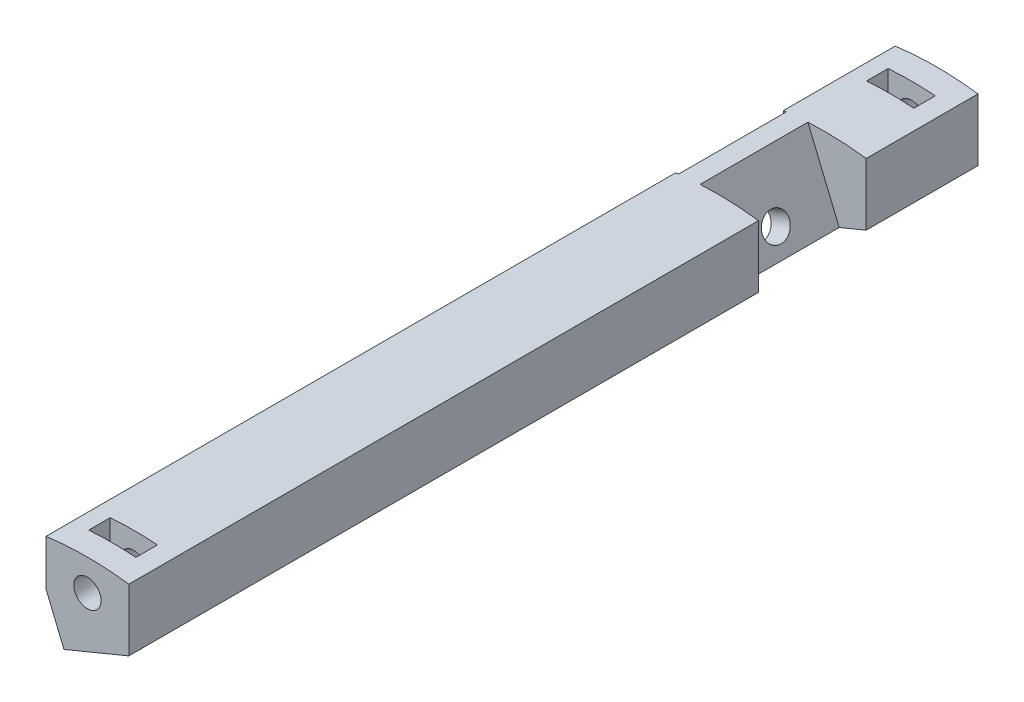
from build123d import *

# Parameters (mm, degrees)
BOSS_EXTRU_2_DEPTH       = 102.5
ESQUISSE8_R              = 1.75
ENL_V_MAT_EXTRU_5_DEPTH  = 11.5
ENL_V_START              = -3
ENL_V_MAT_EXTRU_6_DEPTH  = 2.6
ENL_V_START_2            = -89
ENL_V_MAT_EXTRU_11_DEPTH = 13
ESQUISSE15_R             = 1.625
ENL_V_MAT_EXTRU_12_DEPTH = 109.858621468
CHANFREIN1_SIZE          = 2.5
ESQUISSE16_R             = 1.65
ENL_V_MAT_EXTRU_13_DEPTH = 11.5
ENL_V_START_3            = -5.6
ENL_V_MAT_EXTRU_14_DEPTH = 2.6


with BuildPart() as part:
    # Esquisse3 → Boss.-Extru.2 (new body)
    with BuildSketch(Plane.XY):
        with BuildLine():
            Line((5, 29.665669478), (-2.833530831, 26.427314208))
            Line((-2.833530831, 26.427314208), (-5, 31.657633458))
            Line((-5, 31.657633458), (-5, 37.165171868))
            ThreePointArc((-5, 37.165171868), (0, 37.5), (5, 37.165171868))
            Line((5, 37.165171868), (5, 29.665669478))
        make_face()
    extrude(amount=BOSS_EXTRU_2_DEPTH)

    # Esquisse8 → Enlèv. mat.-Extru.5 (cut)
    with BuildSketch(Plane(origin=(0, 0, 0), x_dir=(-1, 0, 0), z_dir=(0, 0, -1))):
        with Locations((0, 33.75)):
            Circle(ESQUISSE8_R)
    extrude(amount=-ENL_V_MAT_EXTRU_5_DEPTH, mode=Mode.SUBTRACT)

    # Esquisse9 → Enlèv. mat.-Extru.6 (cut)
    with BuildSketch(Plane(origin=(0, 0, 0), x_dir=(-1, 0, 0), z_dir=(0, 0, -1)).offset(ENL_V_START)):
        with BuildLine():
            Line((-2.85, 37.391543162), (-2.85, 31.995448267))
            Line((-2.85, 31.995448267), (0, 30.35))
            Line((0, 30.35), (2.85, 31.995448267))
            Line((2.85, 31.995448267), (2.85, 37.391543162))
            ThreePointArc((2.85, 37.391543162), (0, 37.5), (-2.85, 37.391543162))
        make_face()
    extrude(amount=-ENL_V_MAT_EXTRU_6_DEPTH, mode=Mode.SUBTRACT)

    # Esquisse14 → Enlèv. mat.-Extru.11 (cut)
    with BuildSketch(Plane.XY.offset(102.5).offset(ENL_V_START_2)):
        with BuildLine():
            Line((-2.833530831, 26.427314208), (-0.564385746, 27.365371146))
            Line((-0.564385746, 27.365371146), (-4.642779542, 37.211484761))
            ThreePointArc((-4.642779542, 37.211484761), (-4.821445379, 37.188757232), (-5, 37.165171868))
            Line((-5, 37.165171868), (-5, 31.657633458))
            Line((-5, 31.657633458), (-2.833530831, 26.427314208))
        make_face()
        with BuildLine():
            Line((1.745788964, 28.320930853), (-0.564385746, 27.365371146))
            Line((-0.564385746, 27.365371146), (5, 29.665669478))
            Line((5, 29.665669478), (5, 37.165171868))
            ThreePointArc((5, 37.165171868), (1.48984988, 37.470392943), (-2.03345257, 37.444827021))
            Line((-2.03345257, 37.444827021), (1.745788964, 28.320930853))
        make_face()
    extrude(amount=ENL_V_MAT_EXTRU_11_DEPTH, mode=Mode.SUBTRACT)

    # Esquisse15 → Enlèv. mat.-Extru.12 (cut, through all)
    with BuildSketch(Plane(origin=(11.503085218, 4.764733906, 0), x_dir=(0, 0, -1), z_dir=(0.9238795325112864, 0.38268343236509095, 0))):
        with Locations(Location((-20, 28.49654364, 0), (0, 0, 90))):
            Circle(ESQUISSE15_R)
    extrude(amount=-ENL_V_MAT_EXTRU_12_DEPTH, mode=Mode.SUBTRACT)

    # Chanfrein1
    # the kernel refuses this chamfer: 2.5 mm, written as the material it takes off along each edge
    with BuildSketch(Plane(origin=(-8.775058658, 23.971106609, 13.5), x_dir=(0.010504495520027614, -0.025410210633805018, -0.9996219169112968), z_dir=(0.924146227220892, 0.38203893873974615, 0))) as chanfrein1_piece_1_section:
        Polygon((CHANFREIN1_SIZE * 0.999621916911, CHANFREIN1_SIZE * 0.0274958766106), (-CHANFREIN1_SIZE * 0.0274958766106, CHANFREIN1_SIZE * 0.999621916911), (0, 0), align=None)
    chanfrein1_piece_1 = extrude(amount=8.884603616, mode=Mode.PRIVATE)
    chanfrein1_piece_1 = split(chanfrein1_piece_1, bisect_by=Plane(origin=(-0.88361638, 28.136062073, 12.666666667), z_dir=(-0.9238795325112863, -0.382683432365091, 0)), keep=Keep.TOP, mode=Mode.PRIVATE)
    add(chanfrein1_piece_1, mode=Mode.SUBTRACT)
    with BuildSketch(Plane(origin=(-8.775058658, 23.971106609, 26.5), x_dir=(-0.38189449627778244, 0.9237968231608907, -0.027495876610586317), z_dir=(0.924146227220892, 0.38203893873974615, 0))) as chanfrein1_piece_2_section:
        Polygon((CHANFREIN1_SIZE * 0.999621916911, CHANFREIN1_SIZE * 0.0274958766106), (-CHANFREIN1_SIZE * 0.0274958766106, CHANFREIN1_SIZE * 0.999621916911), (0, 0), align=None)
    chanfrein1_piece_2 = extrude(amount=8.884603616, mode=Mode.PRIVATE)
    chanfrein1_piece_2 = split(chanfrein1_piece_2, bisect_by=Plane(origin=(-0.88361638, 28.136062073, 27.333333333), z_dir=(-0.9238795325112863, -0.382683432365091, 0)), keep=Keep.TOP, mode=Mode.PRIVATE)
    add(chanfrein1_piece_2, mode=Mode.SUBTRACT)

    # Esquisse16 → Enlèv. mat.-Extru.13 (cut)
    with BuildSketch(Plane.XY.offset(102.5)):
        with Locations((0, 33.75)):
            Circle(ESQUISSE16_R)
    extrude(amount=-ENL_V_MAT_EXTRU_13_DEPTH, mode=Mode.SUBTRACT)

    # Esquisse17 → Enlèv. mat.-Extru.14 (cut)
    with BuildSketch(Plane.XY.offset(102.5).offset(ENL_V_START_3)):
        with BuildLine():
            Line((-2.85, 37.391543162), (-2.85, 31.995448267))
            Line((-2.85, 31.995448267), (0, 30.35))
            Line((0, 30.35), (2.85, 31.995448267))
            Line((2.85, 31.995448267), (2.85, 37.391543162))
            ThreePointArc((2.85, 37.391543162), (0, 37.5), (-2.85, 37.391543162))
        make_face()
    extrude(amount=ENL_V_MAT_EXTRU_14_DEPTH, mode=Mode.SUBTRACT)


solid = part.part
